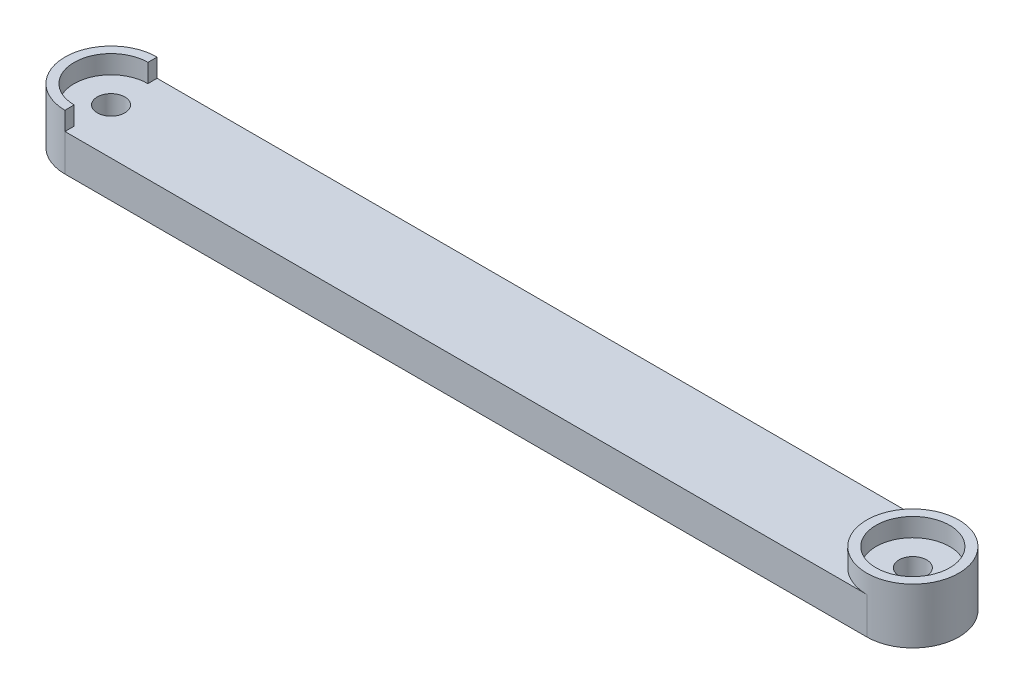
from build123d import *
from build123d.topology import SkipClean

# Parameters (mm, degrees)
SKETCH2_R           = 0.75
BOSS_EXTRUDE1_DEPTH = 2
SKETCH3_R           = 2.5
SKETCH3_R_2         = 2
BOSS_EXTRUDE2_DEPTH = 1


with BuildPart() as part:
    # Sketch2 → Boss-Extrude1 (new body)
    with BuildSketch(Plane(origin=(0, 0, 0), x_dir=(1, 0, 0), z_dir=(0, 1, 0))):
        with BuildLine():
            Line((-21.75, 2.5), (21.75, 2.5))
            ThreePointArc((21.75, 2.5), (24.25, 0), (21.75, -2.5))
            Line((21.75, -2.5), (-21.75, -2.5))
            ThreePointArc((-21.75, -2.5), (-24.25, 0), (-21.75, 2.5))
        make_face()
        with Locations((-21.75, 0)):
            Circle(SKETCH2_R, mode=Mode.SUBTRACT)
        with Locations((21.75, 0)):
            Circle(SKETCH2_R, mode=Mode.SUBTRACT)
    extrude(amount=BOSS_EXTRUDE1_DEPTH)

    # Sketch3 → Boss-Extrude2 (add)
    # profile 1 of 2: a face of its own
    with SkipClean():  # the faces are left unmerged after this step: merging them gives an invalid solid
        with BuildSketch(Plane(origin=(0, 2, 0), x_dir=(1, 0, 0), z_dir=(0, 1, 0))):
            with Locations((21.75, 0)):
                Circle(SKETCH3_R)
            with Locations((21.75, 0)):
                Circle(SKETCH3_R_2, mode=Mode.SUBTRACT)
        # profile 2 of 2: a face of its own
        with BuildSketch(Plane(origin=(0, 2, 0), x_dir=(1, 0, 0), z_dir=(0, 1, 0))):
            with BuildLine():
                Line((-21.75, 2.5), (-21.75, 2))
                ThreePointArc((-21.75, 2), (-23.75, 0), (-21.75, -2))
                Line((-21.75, -2), (-21.75, -2.5))
                ThreePointArc((-21.75, -2.5), (-24.25, 0), (-21.75, 2.5))
            make_face()
        extrude(amount=BOSS_EXTRUDE2_DEPTH)
    add(part.part.scale(1), mode=Mode.REPLACE)  # the faces are merged on a copy


solid = part.part
